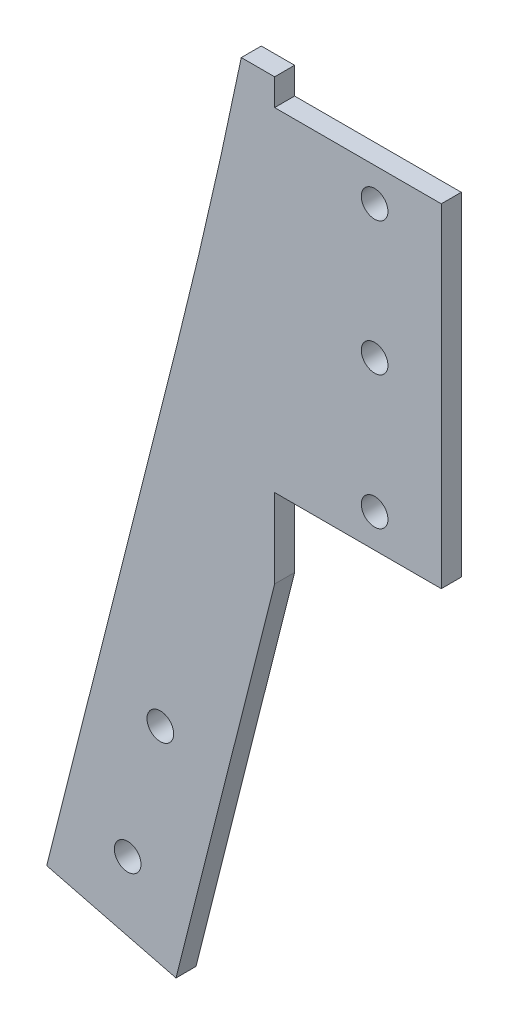
from build123d import *

# Parameters (mm, degrees)
SKETCH_1_R      = 2
SKETCH_1_W      = 5
SKETCH_1_H      = 4
EXTRUDE_1_DEPTH = 3
FILLET_3_R      = 1000


with BuildPart() as part:
    # 草图1 → 凸台-拉伸1 (new body)
    # profile 1 of 2: a face of its own
    with BuildSketch(Plane.XY):
        Polygon((124.141229584, 470), (125, 470), (148, 470), (148, 520), (123, 520), (118, 520), (88.81515415, 404.428010432), (108.206427567, 399.531224216), (118, 438.31377105), (123, 458.11377105), (123, 470), align=None)
        with Locations((100.959183966, 411.675254033)):
            Circle(SKETCH_1_R, mode=Mode.SUBTRACT)
        with Locations((105.855970183, 431.06652745)):
            Circle(SKETCH_1_R, mode=Mode.SUBTRACT)
        with Locations((138, 475)):
            Circle(SKETCH_1_R, mode=Mode.SUBTRACT)
        with Locations((138, 495)):
            Circle(SKETCH_1_R, mode=Mode.SUBTRACT)
        with Locations((138, 515)):
            Circle(SKETCH_1_R, mode=Mode.SUBTRACT)
    # profile 2 of 2: a face of its own
    with BuildSketch(Plane.XY):
        with Locations((120.5, 522)):
            Rectangle(SKETCH_1_W, SKETCH_1_H)
    extrude(amount=EXTRUDE_1_DEPTH)

    # 圆角3
    # the kernel refuses this fillet: 1000 mm, written as the material it adds along each edge
    with BuildSketch(Plane(origin=(118, 520, 0), x_dir=(-0.24483931082618016, -0.9695636708716768, 0), z_dir=(0, 0, 1))) as fillet_3_piece_1:
        with BuildLine():
            CenterArc((40.368274514, -1000), FILLET_3_R, 90, 2.535967308)
            Line((-3.878254683, -0.979357243), (0, 0))
            Line((0, 0), (40.368274514, 0))
        make_face()
    extrude(amount=3)


solid = part.part
